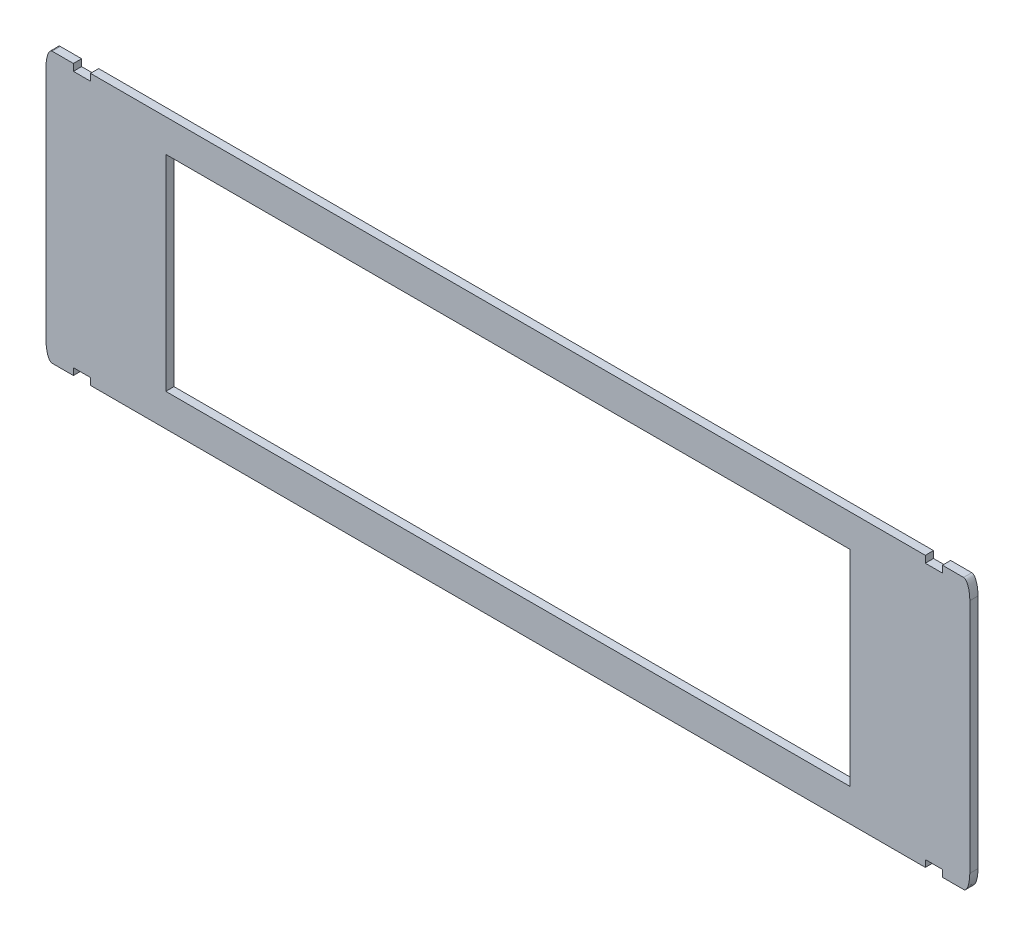
from build123d import *

# Parameters (mm, degrees)
SKETCH_1_W               = 270
SKETCH_1_H               = 79
EXTRUDE_1_DEPTH          = 2.4
SKETCH_2_W               = 200
SKETCH_2_H               = 60
CUT_EXTRUDE_1_DEPTH      = 141.680524594
FILLET_1_SIZE            = 5
FILLET_1_SIZE_2          = 1.8
SKETCH_3_W               = 5
SKETCH_3_H               = 2
CUT_EXTRUDE_2_DEPTH      = 141.68052472
MIRROR_2_COPY_1_SKETCH_W = 5
MIRROR_2_COPY_1_SKETCH_H = 2
MIRROR_2_COPY_1_DEPTH    = 141.68052472


with BuildPart() as part:
    # 草图1 → 凸台-拉伸1 (new body)
    with BuildSketch(Plane.XY):
        Rectangle(SKETCH_1_W, SKETCH_1_H)
    extrude(amount=EXTRUDE_1_DEPTH)

    # 草图2 → 切除-拉伸1 (cut, through all)
    with BuildSketch(Plane.XY.offset(2.4)):
        Rectangle(SKETCH_2_W, SKETCH_2_H)
    extrude(amount=-CUT_EXTRUDE_1_DEPTH, mode=Mode.SUBTRACT)

    # 圆角1
    # an asymmetric fillet: 5, 1.8 mm, written as the material it takes off along each edge
    with BuildSketch(Plane(origin=(135, -39.5, -12.5), x_dir=(0, 1, 0), z_dir=(0, 0, 1))) as fillet_1_piece_1:
        with BuildLine():
            Bezier((FILLET_1_SIZE, 0), (0, 0), (0, FILLET_1_SIZE_2), weights=[1, 0.707106781, 1])
            Line((0, FILLET_1_SIZE_2), (0, 0))
            Line((0, 0), (FILLET_1_SIZE, 0))
        make_face()
    extrude(amount=27.4, mode=Mode.SUBTRACT)
    with BuildSketch(Plane(origin=(135, 39.5, -12.5), x_dir=(-1, 0, 0), z_dir=(0, 0, 1))) as fillet_1_piece_2:
        with BuildLine():
            Bezier((FILLET_1_SIZE_2, 0), (0, 0), (0, FILLET_1_SIZE), weights=[1, 0.707106781, 1])
            Line((0, FILLET_1_SIZE), (0, 0))
            Line((0, 0), (FILLET_1_SIZE_2, 0))
        make_face()
    extrude(amount=27.4, mode=Mode.SUBTRACT)
    with BuildSketch(Plane(origin=(-135, -39.5, -12.5), x_dir=(0, 1, 0), z_dir=(0, 0, 1))) as fillet_1_piece_3:
        with BuildLine():
            Bezier((FILLET_1_SIZE, 0), (0, 0), (0, -FILLET_1_SIZE_2), weights=[1, 0.707106781, 1])
            Line((0, -FILLET_1_SIZE_2), (0, 0))
            Line((0, 0), (FILLET_1_SIZE, 0))
        make_face()
    extrude(amount=27.4, mode=Mode.SUBTRACT)
    with BuildSketch(Plane(origin=(-135, 39.5, -12.5), x_dir=(1, 0, 0), z_dir=(0, 0, 1))) as fillet_1_piece_4:
        with BuildLine():
            Bezier((FILLET_1_SIZE_2, 0), (0, 0), (0, -FILLET_1_SIZE), weights=[1, 0.707106781, 1])
            Line((0, -FILLET_1_SIZE), (0, 0))
            Line((0, 0), (FILLET_1_SIZE_2, 0))
        make_face()
    extrude(amount=27.4, mode=Mode.SUBTRACT)

    # 草图3 → 切除-拉伸2 (cut, through all)
    with BuildSketch(Plane.XY.offset(2.4)):
        with Locations((-124.5, 38.5)):
            Rectangle(SKETCH_3_W, SKETCH_3_H)
    cut_extrude_2 = extrude(amount=-CUT_EXTRUDE_2_DEPTH, mode=Mode.SUBTRACT)

    # 镜向1: 切除-拉伸2 across plane
    add(cut_extrude_2.mirror(Plane.ZX), mode=Mode.SUBTRACT)

    # 镜向2: 切除-拉伸2 across plane
    add(cut_extrude_2.mirror(Plane(origin=(0, 0, 0), x_dir=(0, 0, 1), z_dir=(1, 0, 0))), mode=Mode.SUBTRACT)

    # 镜向2 copy 1 sketch → 镜向2 copy 1 (cut, through all)
    with BuildSketch(Plane(origin=(0, 0, 2.4), x_dir=(-1, 0, 0), z_dir=(0, 0, 1))):
        with Locations((-124.5, 38.5)):
            Rectangle(MIRROR_2_COPY_1_SKETCH_W, MIRROR_2_COPY_1_SKETCH_H)
    extrude(amount=-MIRROR_2_COPY_1_DEPTH, mode=Mode.SUBTRACT)


solid = part.part
